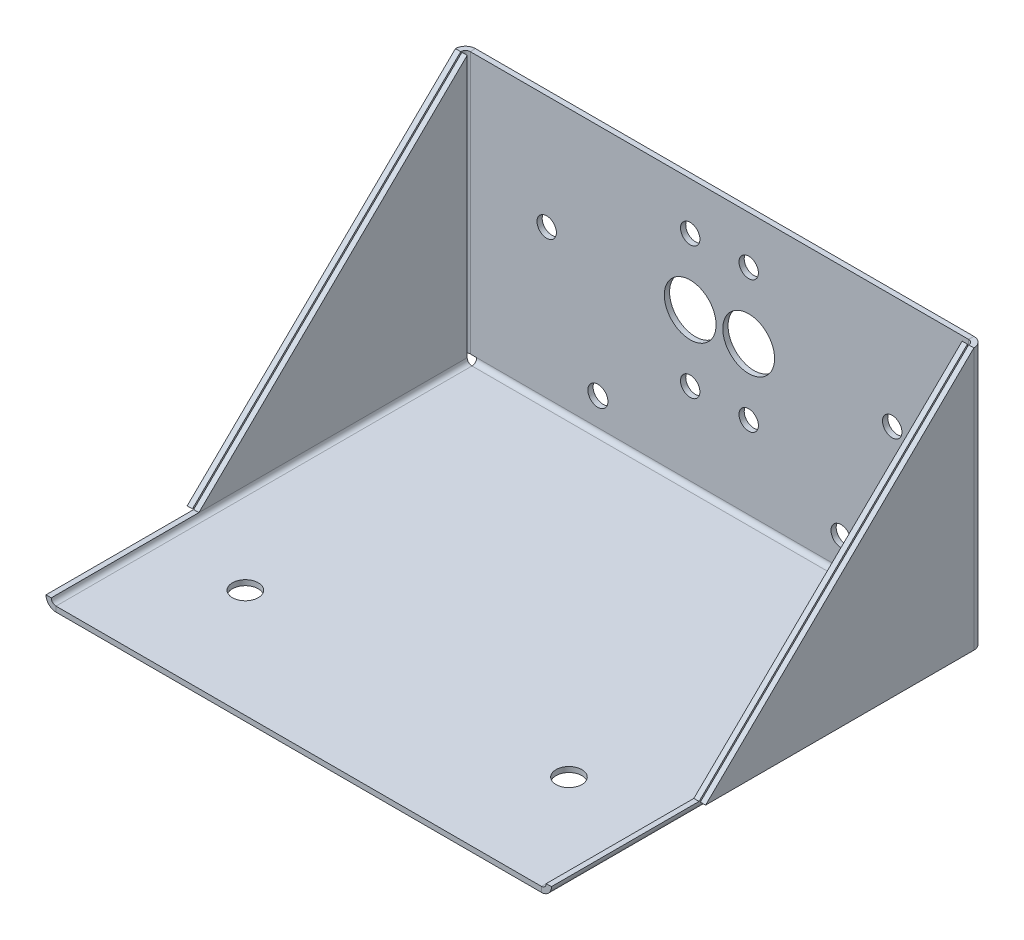
from build123d import *

# Parameters (mm, degrees)
SKETCH1_W                    = 75
SKETCH1_H                    = 65
BASE_FLANGE1_DEPTH           = 0.81
EDGE_FLANGE1_STRIP_W         = 4.7132
EDGE_FLANGE1_STRIP_H         = 0.81
EDGE_FLANGE1_STRIP_CUT_DEPTH = 75
EDGE_FLANGE1_DEPTH           = 75
EDGE_FLANGE2_DEPTH           = 40.4534
EDGE_FLANGE2_BEND_DEPTH      = 40.4534
EDGE_FLANGE3_DEPTH           = 64.2634
EDGE_FLANGE3_BEND_DEPTH      = 64.2634
CUT_EXTRUDE1_REACH           = 113.546
CUT_EXTRUDE2_REACH           = 111.732
SKETCH24_R                   = 4
SKETCH24_R_2                 = 1.5
SKETCH24_R_3                 = 1.55
CUT_EXTRUDE3_REACH           = 111.732
SKETCH25_R                   = 2


# Sheet-metal steps are written as plain solids
with BuildPart() as part:
    # Sketch1 → Base-Flange1 (new body)
    with BuildSketch(Plane(origin=(0, 0, 0), x_dir=(1, 0, 0), z_dir=(0, 1, 0))):
        with Locations((37.5, 32.5)):
            Rectangle(SKETCH1_W, SKETCH1_H)
    extrude(amount=-BASE_FLANGE1_DEPTH)

    # Edge-Flange1 strip (across the edge) → Edge-Flange1 strip cut (cut)
    with BuildSketch(Plane(origin=(75, 0, -65), x_dir=(0, 0, 1), z_dir=(-1, 0, 0))):
        with Locations((-1.62, -0.405)):
            Rectangle(EDGE_FLANGE1_STRIP_W, EDGE_FLANGE1_STRIP_H)
    extrude(amount=EDGE_FLANGE1_STRIP_CUT_DEPTH, mode=Mode.SUBTRACT)

    # Edge-Flange1 section (across the edge) → Edge-Flange1 (add)
    with BuildSketch(Plane(origin=(75, 0, -65), x_dir=(0, 0, 1), z_dir=(-1, 0, 0))):
        with BuildLine():
            Line((-0.81, 0.7366), (-0.81, 41.19))
            Line((-0.81, 41.19), (0, 41.19))
            Line((0, 41.19), (0, 0.7366))
            ThreePointArc((0, 0.7366), (0.215745145, 0.215745145), (0.7366, 0))
            Line((0.7366, 0), (0.7366, -0.81))
            ThreePointArc((0.7366, -0.81), (-0.357011348, -0.357011348), (-0.81, 0.7366))
        make_face()
    extrude(amount=EDGE_FLANGE1_DEPTH)

    # Edge-Flange2 section (across the edge) → Edge-Flange2 (add)
    with BuildSketch(Plane(origin=(-1.7366, 41.19, -65), x_dir=(1, 0, 0), z_dir=(0, -1, 0))):
        with BuildLine():
            Line((-0.81, 0.7366), (-0.81, 42.19))
            Line((-0.81, 42.19), (0, 42.19))
            Line((0, 42.19), (0, 0.7366))
            ThreePointArc((0, 0.7366), (0.215745145, 0.215745145), (0.7366, 0))
            Line((0.7366, 0), (1.7366, 0))
            Line((1.7366, 0), (1.7366, -0.81))
            Line((1.7366, -0.81), (0.7366, -0.81))
            ThreePointArc((0.7366, -0.81), (-0.357011348, -0.357011348), (-0.81, 0.7366))
        make_face()
    extrude(amount=EDGE_FLANGE2_DEPTH)

    # Edge-Flange2 section 2 (across the edge) → Edge-Flange2 bend (add)
    with BuildSketch(Plane(origin=(76.7366, 0.7366, -65), x_dir=(-1, 0, 0), z_dir=(0, 1, 0))):
        with BuildLine():
            Line((-0.81, 0.7366), (-0.81, 42.19))
            Line((-0.81, 42.19), (0, 42.19))
            Line((0, 42.19), (0, 0.7366))
            ThreePointArc((0, 0.7366), (0.215745145, 0.215745145), (0.7366, 0))
            Line((0.7366, 0), (1.7366, 0))
            Line((1.7366, 0), (1.7366, -0.81))
            Line((1.7366, -0.81), (0.7366, -0.81))
            ThreePointArc((0.7366, -0.81), (-0.357011348, -0.357011348), (-0.81, 0.7366))
        make_face()
    extrude(amount=EDGE_FLANGE2_BEND_DEPTH)

    # Edge-Flange3 section (across the edge) → Edge-Flange3 (add)
    with BuildSketch(Plane(origin=(-0.7366, 0, -64.2634), x_dir=(1, 0, 0), z_dir=(0, 0, 1))):
        with BuildLine():
            Line((-0.81, 0.7366), (-0.81, 41.19))
            Line((-0.81, 41.19), (0, 41.19))
            Line((0, 41.19), (0, 0.7366))
            ThreePointArc((0, 0.7366), (0.215745145, 0.215745145), (0.7366, 0))
            Line((0.7366, 0), (0.7366, -0.81))
            ThreePointArc((0.7366, -0.81), (-0.357011348, -0.357011348), (-0.81, 0.7366))
        make_face()
    extrude(amount=EDGE_FLANGE3_DEPTH)

    # Edge-Flange3 section 2 (across the edge) → Edge-Flange3 bend (add)
    with BuildSketch(Plane(origin=(75.7366, 0, 0), x_dir=(-1, 0, 0), z_dir=(0, 0, -1))):
        with BuildLine():
            Line((-0.81, 0.7366), (-0.81, 41.19))
            Line((-0.81, 41.19), (0, 41.19))
            Line((0, 41.19), (0, 0.7366))
            ThreePointArc((0, 0.7366), (0.215745145, 0.215745145), (0.7366, 0))
            Line((0.7366, 0), (0.7366, -0.81))
            ThreePointArc((0.7366, -0.81), (-0.357011348, -0.357011348), (-0.81, 0.7366))
        make_face()
    extrude(amount=EDGE_FLANGE3_BEND_DEPTH)

    # Cut-Extrude1: up to this face of the body (flat: up to its plane)
    cut_extrude1_end = Plane(part.part.faces().sort_by_distance((77.5466, 20.9633, -43.5367))[0])
    # Sketch23 → Cut-Extrude1 (cut, up to the picked face)
    with BuildSketch(Plane.ZY.offset(2.5466), mode=Mode.PRIVATE) as cut_extrude1_sk1:
        Polygon((-64.2634, 41.19), (-22.81, 0.7366), (0, 0.7366), (0, 41.19), align=None)
    cut_extrude1_tool1 = split(extrude(cut_extrude1_sk1.sketch, amount=-CUT_EXTRUDE1_REACH, mode=Mode.PRIVATE), bisect_by=cut_extrude1_end, keep=Keep.BOTH, mode=Mode.PRIVATE)
    add(cut_extrude1_tool1.solids().sort_by(Axis((-2.5466, 24.173103, -23.412925), (1, 0, 0)))[0], mode=Mode.SUBTRACT)

    # Sketch24 → Cut-Extrude2 (cut, up to next)
    with BuildSketch(Plane(origin=(0, 0, -65.81), x_dir=(-1, 0, 0), z_dir=(0, 0, -1)), mode=Mode.PRIVATE) as cut_extrude2_sk1:
        with Locations(Location((-42.01805, 23.62082, 0), (0, 0, 90))):
            Circle(SKETCH24_R)
    cut_extrude2_tool1 = extrude(cut_extrude2_sk1.sketch, amount=-CUT_EXTRUDE2_REACH, mode=Mode.PRIVATE) & part.part
    # Sketch24 → Cut-Extrude2 (cut, up to next)
    with BuildSketch(Plane(origin=(0, 0, -65.81), x_dir=(-1, 0, 0), z_dir=(0, 0, -1)), mode=Mode.PRIVATE) as cut_extrude2_sk2:
        with Locations(Location((-42.01805, 33.83162, 0), (0, 0, 90))):
            Circle(SKETCH24_R_2)
    cut_extrude2_tool2 = extrude(cut_extrude2_sk2.sketch, amount=-CUT_EXTRUDE2_REACH, mode=Mode.PRIVATE) & part.part
    # Sketch24 → Cut-Extrude2 (cut, up to next)
    with BuildSketch(Plane(origin=(0, 0, -65.81), x_dir=(-1, 0, 0), z_dir=(0, 0, -1)), mode=Mode.PRIVATE) as cut_extrude2_sk3:
        with Locations(Location((-64.19225, 23.62082, 0), (0, 0, 90))):
            Circle(SKETCH24_R_2)
    cut_extrude2_tool3 = extrude(cut_extrude2_sk3.sketch, amount=-CUT_EXTRUDE2_REACH, mode=Mode.PRIVATE) & part.part
    # Sketch24 → Cut-Extrude2 (cut, up to next)
    with BuildSketch(Plane(origin=(0, 0, -65.81), x_dir=(-1, 0, 0), z_dir=(0, 0, -1)), mode=Mode.PRIVATE) as cut_extrude2_sk4:
        with Locations(Location((-42.01805, 13.41002, 0), (0, 0, 90))):
            Circle(SKETCH24_R_2)
    cut_extrude2_tool4 = extrude(cut_extrude2_sk4.sketch, amount=-CUT_EXTRUDE2_REACH, mode=Mode.PRIVATE) & part.part
    # Sketch24 → Cut-Extrude2 (cut, up to next)
    with BuildSketch(Plane(origin=(0, 0, -65.81), x_dir=(-1, 0, 0), z_dir=(0, 0, -1)), mode=Mode.PRIVATE) as cut_extrude2_sk5:
        with Locations(Location((-18.720201976, 5, 0), (0, 0, 90))):
            Circle(SKETCH24_R_3)
    cut_extrude2_tool5 = extrude(cut_extrude2_sk5.sketch, amount=-CUT_EXTRUDE2_REACH, mode=Mode.PRIVATE) & part.part
    # Sketch24 → Cut-Extrude2 (cut, up to next)
    with BuildSketch(Plane(origin=(0, 0, -65.81), x_dir=(-1, 0, 0), z_dir=(0, 0, -1)), mode=Mode.PRIVATE) as cut_extrude2_sk6:
        with Locations(Location((-56.279798024, 5, 0), (0, 0, 270))):
            Circle(SKETCH24_R_3)
    cut_extrude2_tool6 = extrude(cut_extrude2_sk6.sketch, amount=-CUT_EXTRUDE2_REACH, mode=Mode.PRIVATE) & part.part
    # Sketch24 → Cut-Extrude2 (cut, up to next)
    with BuildSketch(Plane(origin=(0, 0, -65.81), x_dir=(-1, 0, 0), z_dir=(0, 0, -1)), mode=Mode.PRIVATE) as cut_extrude2_sk7:
        with Locations(Location((-32.98195, 13.41002, 0), (0, 0, 270))):
            Circle(SKETCH24_R_2)
    cut_extrude2_tool7 = extrude(cut_extrude2_sk7.sketch, amount=-CUT_EXTRUDE2_REACH, mode=Mode.PRIVATE) & part.part
    # Sketch24 → Cut-Extrude2 (cut, up to next)
    with BuildSketch(Plane(origin=(0, 0, -65.81), x_dir=(-1, 0, 0), z_dir=(0, 0, -1)), mode=Mode.PRIVATE) as cut_extrude2_sk8:
        with Locations(Location((-10.80775, 23.62082, 0), (0, 0, 270))):
            Circle(SKETCH24_R_2)
    cut_extrude2_tool8 = extrude(cut_extrude2_sk8.sketch, amount=-CUT_EXTRUDE2_REACH, mode=Mode.PRIVATE) & part.part
    # Sketch24 → Cut-Extrude2 (cut, up to next)
    with BuildSketch(Plane(origin=(0, 0, -65.81), x_dir=(-1, 0, 0), z_dir=(0, 0, -1)), mode=Mode.PRIVATE) as cut_extrude2_sk9:
        with Locations(Location((-32.98195, 33.83162, 0), (0, 0, 270))):
            Circle(SKETCH24_R_2)
    cut_extrude2_tool9 = extrude(cut_extrude2_sk9.sketch, amount=-CUT_EXTRUDE2_REACH, mode=Mode.PRIVATE) & part.part
    # Sketch24 → Cut-Extrude2 (cut, up to next)
    with BuildSketch(Plane(origin=(0, 0, -65.81), x_dir=(-1, 0, 0), z_dir=(0, 0, -1)), mode=Mode.PRIVATE) as cut_extrude2_sk10:
        with Locations(Location((-32.98195, 23.62082, 0), (0, 0, 270))):
            Circle(SKETCH24_R)
    cut_extrude2_tool10 = extrude(cut_extrude2_sk10.sketch, amount=-CUT_EXTRUDE2_REACH, mode=Mode.PRIVATE) & part.part
    add(cut_extrude2_tool1.solids().sort_by_distance((42.01805, 23.62082, -65.81))[0], mode=Mode.SUBTRACT)
    add(cut_extrude2_tool2.solids().sort_by_distance((42.01805, 33.83162, -65.81))[0], mode=Mode.SUBTRACT)
    add(cut_extrude2_tool3.solids().sort_by_distance((64.19225, 23.62082, -65.81))[0], mode=Mode.SUBTRACT)
    add(cut_extrude2_tool4.solids().sort_by_distance((42.01805, 13.41002, -65.81))[0], mode=Mode.SUBTRACT)
    add(cut_extrude2_tool5.solids().sort_by_distance((18.720202, 5, -65.81))[0], mode=Mode.SUBTRACT)
    add(cut_extrude2_tool6.solids().sort_by_distance((56.279798, 5, -65.81))[0], mode=Mode.SUBTRACT)
    add(cut_extrude2_tool7.solids().sort_by_distance((32.98195, 13.41002, -65.81))[0], mode=Mode.SUBTRACT)
    add(cut_extrude2_tool8.solids().sort_by_distance((10.80775, 23.62082, -65.81))[0], mode=Mode.SUBTRACT)
    add(cut_extrude2_tool9.solids().sort_by_distance((32.98195, 33.83162, -65.81))[0], mode=Mode.SUBTRACT)
    add(cut_extrude2_tool10.solids().sort_by_distance((32.98195, 23.62082, -65.81))[0], mode=Mode.SUBTRACT)

    # Sketch25 → Cut-Extrude3 (cut, up to next)
    with BuildSketch(Plane(origin=(0, 0, 0), x_dir=(1, 0, 0), z_dir=(0, 1, 0)), mode=Mode.PRIVATE) as cut_extrude3_sk1:
        with Locations(Location((62.5, 16.75, 0), (0, 0, 270))):
            Circle(SKETCH25_R)
    cut_extrude3_tool1 = extrude(cut_extrude3_sk1.sketch, amount=-CUT_EXTRUDE3_REACH, mode=Mode.PRIVATE) & part.part
    # Sketch25 → Cut-Extrude3 (cut, up to next)
    with BuildSketch(Plane(origin=(0, 0, 0), x_dir=(1, 0, 0), z_dir=(0, 1, 0)), mode=Mode.PRIVATE) as cut_extrude3_sk2:
        with Locations(Location((12.5, 16.75, 0), (0, 0, 270))):
            Circle(SKETCH25_R)
    cut_extrude3_tool2 = extrude(cut_extrude3_sk2.sketch, amount=-CUT_EXTRUDE3_REACH, mode=Mode.PRIVATE) & part.part
    add(cut_extrude3_tool1.solids().sort_by_distance((62.5, 0, -16.75))[0], mode=Mode.SUBTRACT)
    add(cut_extrude3_tool2.solids().sort_by_distance((12.5, 0, -16.75))[0], mode=Mode.SUBTRACT)


solid = part.part
